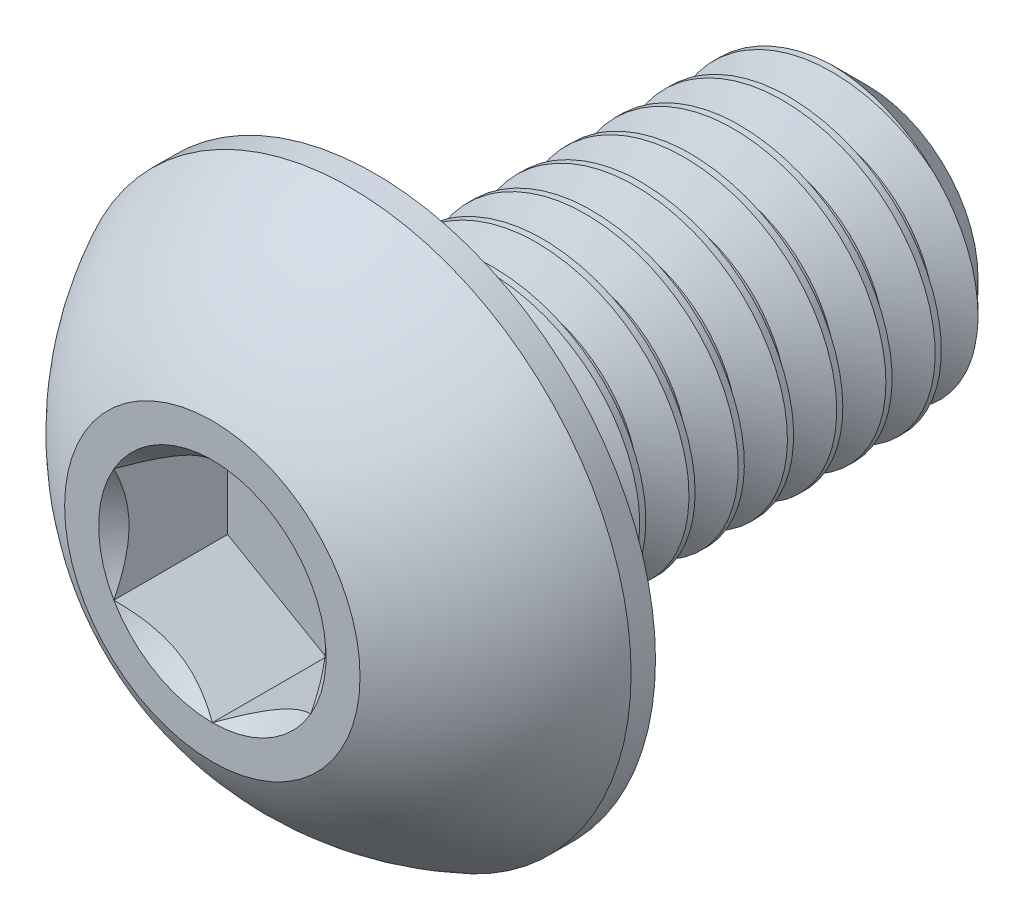
from build123d import *

# Parameters (mm, degrees)
PROFILE_SKETCH_W   = 5
PROFILE_SKETCH_H   = 1.5
CHAMFER1_SIZE      = 0.375
CUT_EXTRUDE2_DEPTH = 1.155
CUT_SWEEP1_PITCH   = 0.5


with BuildPart() as part:
    # Profile Sketch → Revolve1 (revolve)
    with BuildSketch(Plane(origin=(0, 0, 0), x_dir=(0, 0, -1), z_dir=(1, 0, 0))):
        with Locations((4.15, 0.75)):
            Rectangle(PROFILE_SKETCH_W, PROFILE_SKETCH_H)
    revolve(axis=Axis((0, 0, -6.65), (0, 0, 1)))

    # Chamfer1
    chamfer1_edges = [part.edges().sort_by_distance(p)[0] for p in [
        (0, -1.5, -6.65),
    ]]
    chamfer(chamfer1_edges, length=CHAMFER1_SIZE)

    # Sketch7 → Revolve2 (revolve)
    with BuildSketch(Plane(origin=(0, 0, 0), x_dir=(0, 0, -1), z_dir=(1, 0, 0)), mode=Mode.PRIVATE) as revolve2_sk:
        with BuildLine():
            Line((1.4025, 2.85), (1.65, 2.85))
            Line((1.65, 2.85), (1.65, 0))
            Line((1.65, 0), (0, 0))
            Line((0, 0), (0, 1.5))
            ThreePointArc((0, 1.5), (0.59512511, 2.285251969), (1.4025, 2.85))
        make_face()
    revolve(revolve2_sk.sketch.rotate(Axis((0, 0, 0), (0, 0, -1)), 180), axis=Axis((0, 0, 0), (0, 0, -1)))

    # Sketch5 → Cut-Extrude2 (cut)
    with BuildSketch(Plane.XY):
        Polygon((1, -0.577350269), (1, 0.577350269), (0, 1.154700538), (-1, 0.577350269), (-1, -0.577350269), (0, -1.154700538), align=None)
    extrude(amount=-CUT_EXTRUDE2_DEPTH, mode=Mode.SUBTRACT)

    # Cut-Extrude3 cone 1 section (through the dimple's axis) → Cut-Extrude3 (revolve, cut)
    with BuildSketch(Plane(origin=(0, 0, 0), x_dir=(0, -1, 0), z_dir=(1, 0, 0))):
        Polygon((0, 0), (1.154700538, 0), (0, 1.154700538), align=None)
    revolve(axis=Axis((0, 0, 0), (0, 0, -1)), mode=Mode.SUBTRACT)

    # Cut-Sweep1: the profile of Sketch2 profile screwed along a right-hand helix of 11 turns, 6 arcs to a turn; built about Z, then put on its axis
    cut_sweep1_z = Axis((0, 0, 0), (0, 0, 1))
    cut_sweep1_corners = [(1.5003, 0, 0.375173205), (1.5003, 0, -0.062673205), (1.175240474, 0, 0.125), (1.175240474, 0, 0.1875)]
    with BuildLine(mode=Mode.PRIVATE) as cut_sweep1_profile:
        Line(cut_sweep1_corners[0], cut_sweep1_corners[1])
        Line(cut_sweep1_corners[1], cut_sweep1_corners[2])
        Line(cut_sweep1_corners[2], cut_sweep1_corners[3])
        Line(cut_sweep1_corners[3], cut_sweep1_corners[0])
    cut_sweep1_cap = Face(cut_sweep1_profile.wire())
    cut_sweep1_turn_angles = [0, 30, 60, 90, 120, 150, 180, 210, 240, 270, 300, 330, 360]
    cut_sweep1_turn_weights = [1, 0.8660254037844387, 1, 0.8660254037844387, 1, 0.8660254037844387, 1, 0.8660254037844387, 1, 0.8660254037844387, 1, 0.8660254037844387, 1]
    cut_sweep1_turn_rails = [Edge.make_bspline([Vector(p[0], p[1], 0).rotate(cut_sweep1_z, cut_sweep1_turn_angles[k]) / cut_sweep1_turn_weights[k] + Vector(0, 0, p[2] + CUT_SWEEP1_PITCH * cut_sweep1_turn_angles[k] / 360) for k in range(13)], [0, 0, 0, 1, 1, 2, 2, 3, 3, 4, 4, 5, 5, 6, 6, 6], 2, cut_sweep1_turn_weights) for p in cut_sweep1_corners]
    cut_sweep1_turn_sides = [Face.make_surface_from_curves(cut_sweep1_turn_rails[p[0]], cut_sweep1_turn_rails[p[1]]) for p in [(0, 1), (1, 2), (2, 3), (3, 0)]]
    cut_sweep1 = Plane(origin=(0, 0, -6.65), x_dir=(0, 1, 0), z_dir=(0, 0, 1)) * Solid(Shell([*[p.moved(Location((0, 0, CUT_SWEEP1_PITCH * i))) for i in range(11) for p in cut_sweep1_turn_sides], cut_sweep1_cap, cut_sweep1_cap.rotate(cut_sweep1_z, 3960).moved(Location((0, 0, CUT_SWEEP1_PITCH * 3960 / 360)))]))
    add(cut_sweep1, mode=Mode.SUBTRACT)


solid = part.part
